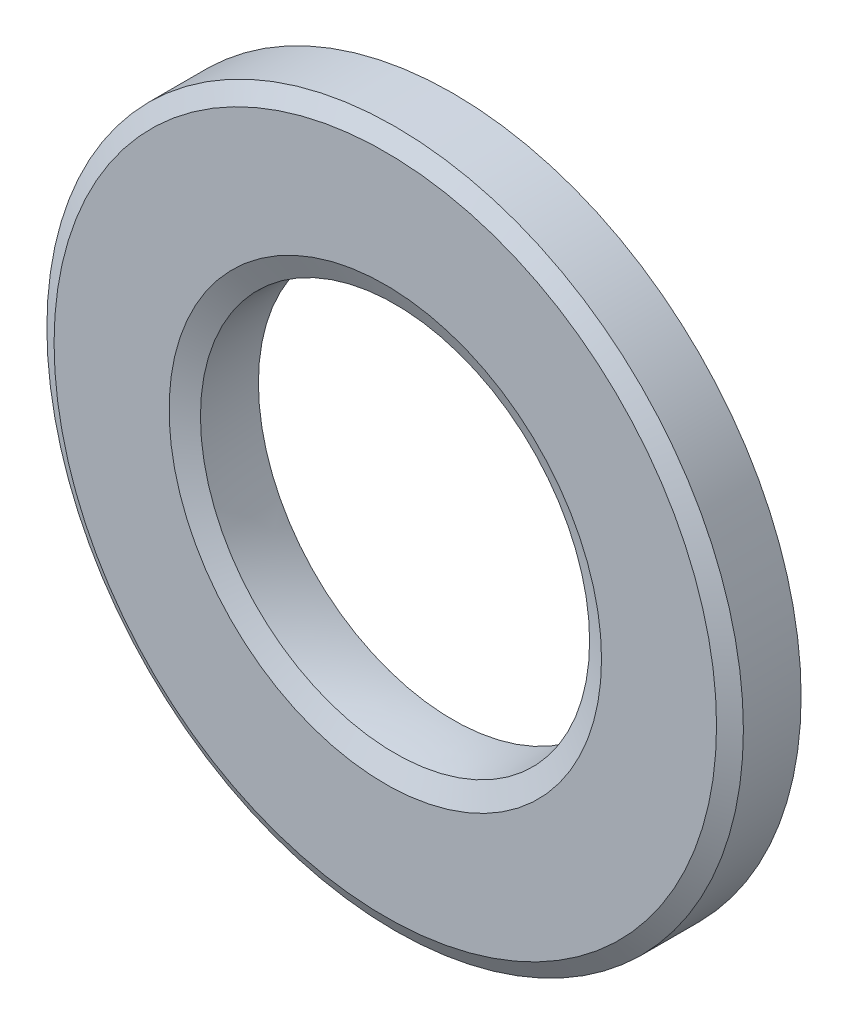
from build123d import *
from OCP.BRepFilletAPI import BRepFilletAPI_MakeChamfer

# Parameters (mm, degrees)
BOSS_EXTRUDE1_DEPTH      = 1
BOSS_EXTRUDE1_DEPTH_BACK = 1
SKETCH3_R                = 9
SKETCH3_R_2              = 5
CHAMFER1_SIZE            = 0.254
CHAMFER1_SIZE2           = 0.439940905
CHAMFER2_SIZE            = 0.536952942


with BuildPart() as part:
    # Sketch3 → Boss-Extrude1 (new, two sides: drawn at the far end of the back side and taken through both)
    with BuildSketch(Plane.XY.offset(-BOSS_EXTRUDE1_DEPTH_BACK)):
        Circle(SKETCH3_R)
        Circle(SKETCH3_R_2, mode=Mode.SUBTRACT)
    extrude(amount=BOSS_EXTRUDE1_DEPTH + BOSS_EXTRUDE1_DEPTH_BACK)

    # Chamfer1: one chamfer whose edges measure the first distance from different faces: ONE call of the kernel's chamfer builder (chamfer() names one face for all edges)
    chamfer1_edges_1 = [part.edges().sort_by_distance(p)[0] for p in [
        (-9, 0, 1),
    ]]
    chamfer1_side_1 = [part.faces().sort_by_distance(p)[0] for p in [
        (-9, 0, 0.5),
    ]]
    chamfer1_edges_2 = [part.edges().sort_by_distance(p)[0] for p in [
        (-9, 0, -1),
    ]]
    chamfer1_side_2 = [part.faces().sort_by_distance(p)[0] for p in [
        (-9, 0, -0.5),
    ]]
    chamfer1 = BRepFilletAPI_MakeChamfer(part.part.solid().wrapped)
    for e in chamfer1_edges_1:
        chamfer1.Add(CHAMFER1_SIZE, CHAMFER1_SIZE2, e.wrapped, chamfer1_side_1[0].wrapped)  # the first distance lies on this face
    for e in chamfer1_edges_2:
        chamfer1.Add(CHAMFER1_SIZE, CHAMFER1_SIZE2, e.wrapped, chamfer1_side_2[0].wrapped)  # the first distance lies on this face
    add(Compound.cast(chamfer1.Shape()), mode=Mode.REPLACE)

    # Sketch4 → Cut-Revolve1 (revolve, cut)
    with BuildSketch(Plane(origin=(0, 0, 0), x_dir=(0, 0, -1), z_dir=(1, 0, 0)), mode=Mode.PRIVATE) as cut_revolve1_sk:
        with BuildLine():
            Line((-1, 4.9492), (-1, 5.0508))
            ThreePointArc((-1, 5.0508), (0, 5), (1, 5.0508))
            Line((1, 5.0508), (1, 4.9492))
            Line((1, 4.9492), (-1, 4.9492))
        make_face()
    revolve(cut_revolve1_sk.sketch.rotate(Axis((0, 0, 1), (0, 0, -1)), 90), axis=Axis((0, 0, 1), (0, 0, -1)), mode=Mode.SUBTRACT)

    # Chamfer2
    # the kernel refuses this chamfer: 0.536952942, 0.254 mm, written as the material it takes off along each edge
    with BuildSketch(Plane(origin=(0, 0, -1), x_dir=(1, 0, 0), z_dir=(0, 1, 0))) as chamfer2_piece_1:
        with BuildLine():
            Line((5.0508 + CHAMFER2_SIZE, 0), (5.028453739, -0.251168371))
            ThreePointArc((5.028453739, -0.251168371), (5.038361074, -0.130738), (5.0508, 0))
            Line((5.0508, 0), (5.0508 + CHAMFER2_SIZE, 0))
        make_face()
    revolve(axis=Axis((0, 0, -1), (0, 0, -1)), mode=Mode.SUBTRACT)
    with BuildSketch(Plane(origin=(0, 0, 1), x_dir=(1, 0, 0), z_dir=(0, 1, 0))) as chamfer2_piece_2:
        with BuildLine():
            Line((5.0508 + CHAMFER2_SIZE, 0), (5.028453739, 0.251168371))
            ThreePointArc((5.028453739, 0.251168371), (5.038361074, 0.130738), (5.0508, 0))
            Line((5.0508, 0), (5.0508 + CHAMFER2_SIZE, 0))
        make_face()
    revolve(axis=Axis((0, 0, 1), (0, 0, -1)), mode=Mode.SUBTRACT)


solid = part.part
